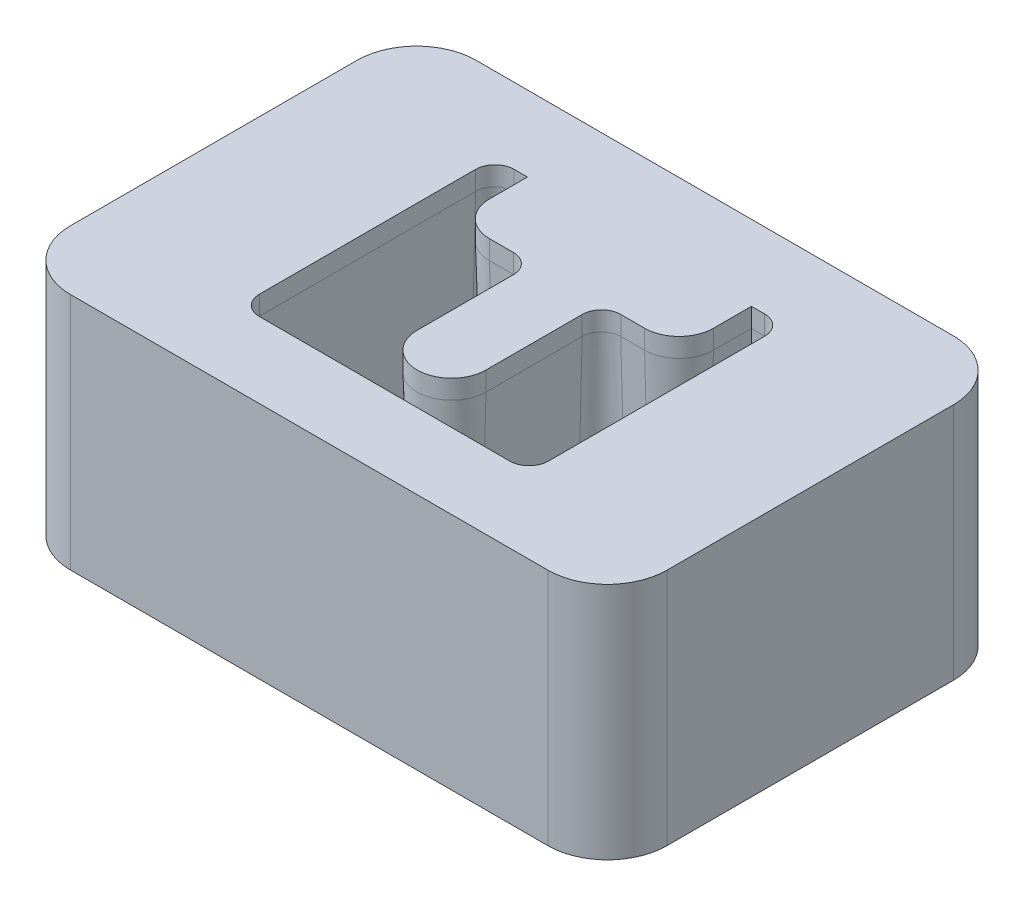
from build123d import *

# Parameters (mm, degrees)
SKETCH1_W                   = 100
SKETCH1_H                   = 68
BOSS_EXTRUDE1_DEPTH         = 40
FILLET1_R                   = 10
CUT_EXTRUDE1_REACH          = 74.498
M6_TAPPED_HOLE1_D           = 5
M6_TAPPED_HOLE1_DEPTH       = 17
M6_TAPPED_HOLE1_CSINK_D     = 6.05
M6_TAPPED_HOLE1_CSINK_ANGLE = 90
M6_TAPPED_HOLE1_TIP         = 1.502151548


with BuildPart() as part:
    # Sketch1 → Boss-Extrude1 (new body)
    with BuildSketch(Plane(origin=(0, 0, 0), x_dir=(1, 0, 0), z_dir=(0, 1, 0))):
        Rectangle(SKETCH1_W, SKETCH1_H)
    extrude(amount=-BOSS_EXTRUDE1_DEPTH)

    # Fillet1
    fillet1_edges = [part.edges().sort_by_distance(p)[0] for p in [
        (-50, -20, -34),
        (50, -20, -34),
        (50, -20, 34),
        (-50, -20, 34),
    ]]
    fillet(fillet1_edges, radius=FILLET1_R)

    # Sketch2 → Cut-Extrude1 (cut, up to next)
    with BuildSketch(Plane(origin=(0, 0, 0), x_dir=(1, 0, 0), z_dir=(0, 1, 0)), mode=Mode.PRIVATE) as cut_extrude1_sk1:
        with BuildLine():
            Line((-21, -21.36), (21, -21.36))
            ThreePointArc((21, -21.36), (23.283954903, -20.413954903), (24.23, -18.13))
            Line((24.23, -18.13), (24.23, 18.13))
            ThreePointArc((24.23, 18.13), (23.283954903, 20.413954903), (21, 21.36))
            Line((21, 21.36), (18.77, 21.36))
            Line((18.77, 21.36), (18.77, 15))
            ThreePointArc((18.77, 15), (17.080006127, 10.919993873), (13, 9.23))
            Line((13, 9.23), (9, 9.23))
            ThreePointArc((9, 9.23), (6.716045097, 8.283954903), (5.77, 6))
            Line((5.77, 6), (5.77, -10.13))
            ThreePointArc((5.77, -10.13), (0, -15.9), (-5.77, -10.13))
            Line((-5.77, -10.13), (-5.77, 6))
            ThreePointArc((-5.77, 6), (-6.716045097, 8.283954903), (-9, 9.23))
            Line((-9, 9.23), (-13, 9.23))
            ThreePointArc((-13, 9.23), (-17.080006127, 10.919993873), (-18.77, 15))
            Line((-18.77, 15), (-18.77, 21.36))
            Line((-18.77, 21.36), (-21, 21.36))
            ThreePointArc((-21, 21.36), (-23.283954903, 20.413954903), (-24.23, 18.13))
            Line((-24.23, 18.13), (-24.23, -18.13))
            ThreePointArc((-24.23, -18.13), (-23.283954903, -20.413954903), (-21, -21.36))
        make_face()
    cut_extrude1_tool1 = extrude(cut_extrude1_sk1.sketch, amount=-CUT_EXTRUDE1_REACH, mode=Mode.PRIVATE) & part.part
    add(cut_extrude1_tool1.solids().sort_by_distance((23.583984, 0, 0))[0], mode=Mode.SUBTRACT)

    # Cut-Sweep1: sweep along a path in Sketch5
    with BuildLine(Plane(origin=(0, 0, 0), x_dir=(1, 0, 0), z_dir=(0, 1, 0))) as cut_sweep1_path:
        Line((-21, -21.36), (21, -21.36))
        ThreePointArc((21, -21.36), (23.283954903, -20.413954903), (24.23, -18.13))
        Line((24.23, -18.13), (24.23, 18.13))
        ThreePointArc((24.23, 18.13), (23.283954903, 20.413954903), (21, 21.36))
        Line((21, 21.36), (18.77, 21.36))
        Line((18.77, 21.36), (18.77, 15))
        ThreePointArc((18.77, 15), (17.080006127, 10.919993873), (13, 9.23))
        Line((13, 9.23), (9, 9.23))
        ThreePointArc((9, 9.23), (6.716045097, 8.283954903), (5.77, 6))
        Line((5.77, 6), (5.77, -10.13))
        ThreePointArc((5.77, -10.13), (0, -15.9), (-5.77, -10.13))
        Line((-5.77, -10.13), (-5.77, 6))
        ThreePointArc((-5.77, 6), (-6.716045097, 8.283954903), (-9, 9.23))
        Line((-9, 9.23), (-13, 9.23))
        ThreePointArc((-13, 9.23), (-17.080006127, 10.919993873), (-18.77, 15))
        Line((-18.77, 15), (-18.77, 21.36))
        Line((-18.77, 21.36), (-21, 21.36))
        ThreePointArc((-21, 21.36), (-23.283954903, 20.413954903), (-24.23, 18.13))
        Line((-24.23, 18.13), (-24.23, -18.13))
        ThreePointArc((-24.23, -18.13), (-23.283954903, -20.413954903), (-21, -21.36))
    # Sketch3 → Cut-Sweep1 (sweep, cut)
    with BuildSketch(Plane.XY):
        Polygon((24.23, -3.2), (25.193641914, -40), (23.23, -40), (23.23, -3.2), align=None)
    sweep(path=cut_sweep1_path.line, transition=Transition.RIGHT, mode=Mode.SUBTRACT)

    # M6 Tapped Hole1
    with Locations(Plane(origin=(0, -40, 0), x_dir=(-1, 0, 0), z_dir=(0, -1, 0))):
        with Locations((-43, 27), (43, 27), (43, -27), (-43, -27)):
            CounterSinkHole(M6_TAPPED_HOLE1_D / 2, M6_TAPPED_HOLE1_CSINK_D / 2, depth=M6_TAPPED_HOLE1_DEPTH, counter_sink_angle=M6_TAPPED_HOLE1_CSINK_ANGLE)
            with Locations((0, 0, -(M6_TAPPED_HOLE1_DEPTH + M6_TAPPED_HOLE1_TIP / 2))):  # 118° drill point
                Cone(0, M6_TAPPED_HOLE1_D / 2, M6_TAPPED_HOLE1_TIP, mode=Mode.SUBTRACT)


solid = part.part
